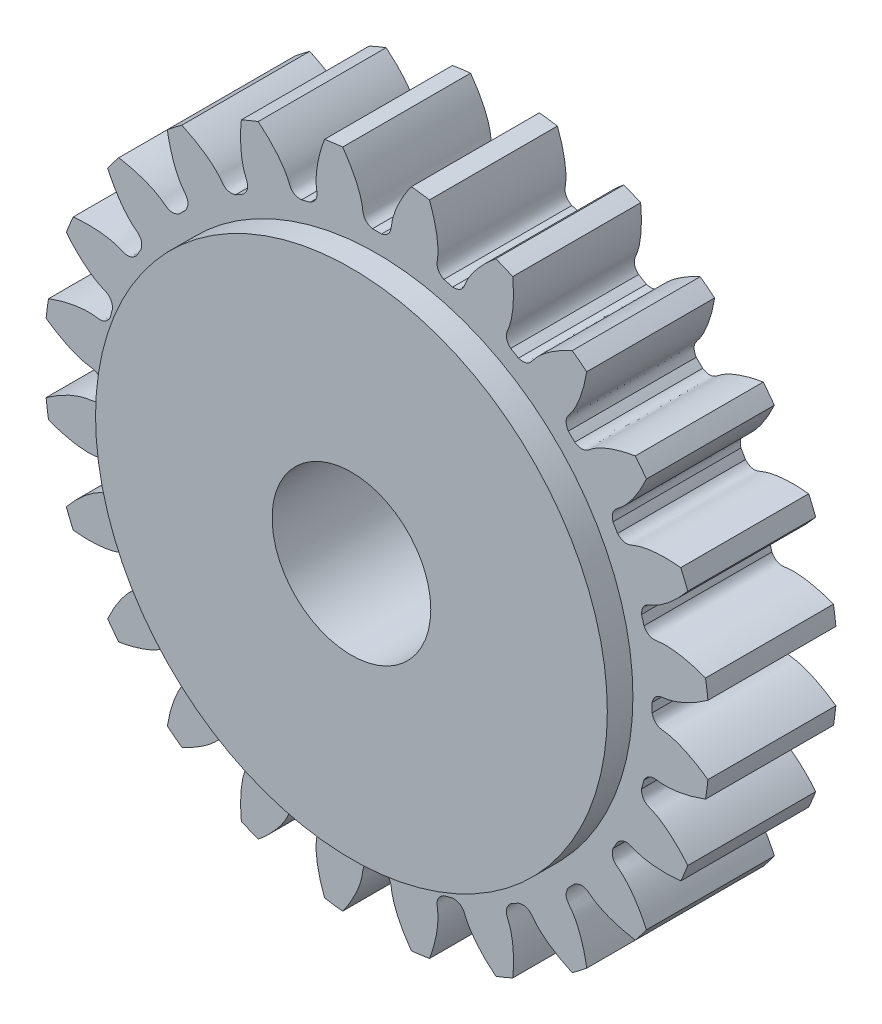
from build123d import *

# Parameters (mm, degrees)
SKETCH_1_R               = 6.5
EXTRUDE_1_DEPTH          = 2.5
CUT_EXTRUDE_1_DEPTH      = 10.526279442
PATTERN_CIRCULAR_1_COUNT = 24
SKETCH_6_R               = 5
EXTRUDE_2_DEPTH          = 0.5
SKETCH_4_R               = 1.55
CUT_EXTRUDE_2_DEPTH      = 5


with BuildPart() as part:
    # 草图1 → 凸台-拉伸1 (new body)
    with BuildSketch(Plane.XY):
        Circle(SKETCH_1_R)
    extrude(amount=EXTRUDE_1_DEPTH)

    # 草图2 → 切除-拉伸1 (cut, through all)
    with BuildSketch(Plane.XY):
        with BuildLine():
            ThreePointArc((0.088415956, 5.374272753), (0, 5.375), (-0.088415956, 5.374272753))
            add(Edge.make_bspline(
                [(-0.088415956, 5.374272753), (-0.283956108, 5.428430036), (-0.269523883, 5.557861799), (-0.293138588, 5.686342226), (-0.296517959, 5.702916521), (-0.300724242, 5.721620073), (-0.305840304, 5.742426358), (-0.311952817, 5.765305336), (-0.319146149, 5.790224685), (-0.327504211, 5.817149434), (-0.337109789, 5.846042111), (-0.348044663, 5.876862729), (-0.360389484, 5.909568827), (-0.374223721, 5.944115495), (-0.389625595, 5.980455405), (-0.406672011, 6.018538843), (-0.425438499, 6.058313744), (-0.445999145, 6.099725726), (-0.468426535, 6.142718129), (-0.492791687, 6.187232054), (-0.519163995, 6.233206399), (-0.547611171, 6.280577906), (-0.57819918, 6.329281201), (-0.610992189, 6.379248841), (-0.64605251, 6.430411359), (-0.68344054, 6.482697309), (-0.723214712, 6.53603332), (-0.765431443, 6.590344144), (-0.810145078, 6.645552705), (-0.857407842, 6.701580158), (-0.907269792, 6.758345935), (-0.959778768, 6.81576781), (-1.014980347, 6.873761948), (-1.0729178, 6.932242967), (-1.133632047, 6.991123994), (-1.197161611, 7.05031673), (-1.263542589, 7.109731505), (-1.332808587, 7.169277345), (-1.430211047, 7.249680778), (-1.505961903, 7.308439159), (-1.55780976, 7.347058965)],
                knots=[0, 0, 0, 0, 0.143961355, 0.149818462, 0.156576662, 0.164235955, 0.172796342, 0.182257821, 0.192620395, 0.203884061, 0.216048821, 0.229114674, 0.24308162, 0.25794966, 0.273718793, 0.290389019, 0.307960339, 0.326432751, 0.345806258, 0.366080857, 0.38725655, 0.409333336, 0.432311215, 0.456190188, 0.480970254, 0.506651413, 0.533233666, 0.560717012, 0.589101451, 0.618386984, 0.64857361, 0.679661329, 0.711650141, 0.744540047, 0.778331046, 0.813023138, 0.848616324, 0.885110603, 0.922505975, 1, 1, 1, 1], degree=3))
            ThreePointArc((-1.55780976, 7.347058965), (0, 7.510395907), (1.55780976, 7.347058965))
            add(Edge.make_bspline(
                [(0.088415956, 5.374272753), (0.283956108, 5.428430036), (0.269523883, 5.557861799), (0.293138588, 5.686342226), (0.296517959, 5.702916521), (0.300724242, 5.721620073), (0.305840304, 5.742426358), (0.311952817, 5.765305336), (0.319146149, 5.790224685), (0.327504211, 5.817149434), (0.337109789, 5.846042111), (0.348044663, 5.876862729), (0.360389484, 5.909568827), (0.374223721, 5.944115495), (0.389625595, 5.980455405), (0.406672011, 6.018538843), (0.425438499, 6.058313744), (0.445999145, 6.099725726), (0.468426535, 6.142718129), (0.492791687, 6.187232054), (0.519163995, 6.233206399), (0.547611171, 6.280577906), (0.57819918, 6.329281201), (0.610992189, 6.379248841), (0.64605251, 6.430411359), (0.68344054, 6.482697309), (0.723214712, 6.53603332), (0.765431443, 6.590344144), (0.810145078, 6.645552705), (0.857407842, 6.701580158), (0.907269792, 6.758345935), (0.959778768, 6.81576781), (1.014980347, 6.873761948), (1.0729178, 6.932242967), (1.133632047, 6.991123994), (1.197161611, 7.05031673), (1.263542589, 7.109731505), (1.332808587, 7.169277345), (1.430211047, 7.249680778), (1.505961903, 7.308439159), (1.55780976, 7.347058965)],
                knots=[0, 0, 0, 0, 0.143961355, 0.149818462, 0.156576662, 0.164235955, 0.172796342, 0.182257821, 0.192620395, 0.203884061, 0.216048821, 0.229114674, 0.24308162, 0.25794966, 0.273718793, 0.290389019, 0.307960339, 0.326432751, 0.345806258, 0.366080857, 0.38725655, 0.409333336, 0.432311215, 0.456190188, 0.480970254, 0.506651413, 0.533233666, 0.560717012, 0.589101451, 0.618386984, 0.64857361, 0.679661329, 0.711650141, 0.744540047, 0.778331046, 0.813023138, 0.848616324, 0.885110603, 0.922505975, 1, 1, 1, 1], degree=3))
        make_face()
    cut_extrude_1 = extrude(amount=CUT_EXTRUDE_1_DEPTH, mode=Mode.SUBTRACT)

    # 阵列(圆周)1: 切除-拉伸1 ×24 about axis
    pattern_circular_1_axis = Axis((0, 0, 2.5), (0, 0, -1))
    for i in range(1, PATTERN_CIRCULAR_1_COUNT):
        add(cut_extrude_1.rotate(pattern_circular_1_axis, i * 360 / PATTERN_CIRCULAR_1_COUNT), mode=Mode.SUBTRACT)

    # 草图6 → 凸台-拉伸2 (add)
    with BuildSketch(Plane.XY.offset(2.5)):
        Circle(SKETCH_6_R)
    extrude(amount=EXTRUDE_2_DEPTH)

    # 草图4 → 切除-拉伸2 (cut, symmetric)
    with BuildSketch(Plane.XY.offset(2.5)):
        Circle(SKETCH_4_R)
    extrude(amount=CUT_EXTRUDE_2_DEPTH, both=True, mode=Mode.SUBTRACT)


solid = part.part
